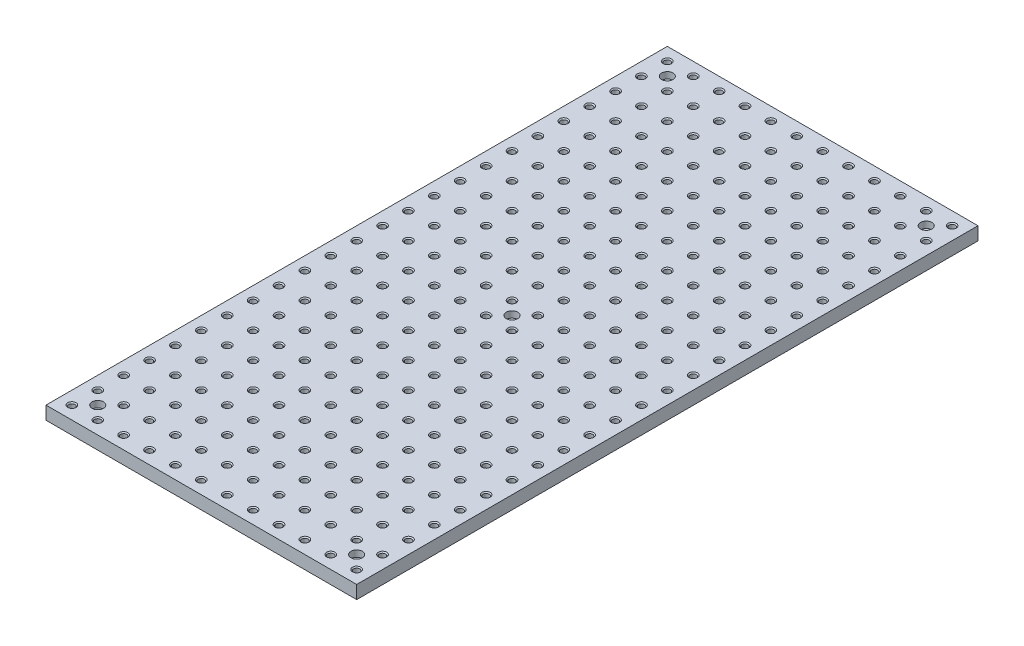
from build123d import *

# Parameters (mm, degrees)
SKETCH1_W                               = 300
SKETCH1_H                               = 600
BOSS_EXTRUDE1_DEPTH                     = 12.7
CBORE_FOR_M6_HEX_HEAD_BOLT1_D           = 6.6
CBORE_FOR_M6_HEX_HEAD_BOLT1_CBORE_D     = 11
CBORE_FOR_M6_HEX_HEAD_BOLT1_CBORE_DEPTH = 6.2
F_5_0_5_DIAMETER_HOLE1_OUTLINE_R        = 3
F_5_0_5_DIAMETER_HOLE1_DEPTH            = 12.7
CHAMFER1_SIZE                           = 1


with BuildPart() as part:
    # Sketch1 → Boss-Extrude1 (new body)
    with BuildSketch(Plane.XZ):
        with Locations((150, -300)):
            Rectangle(SKETCH1_W, SKETCH1_H)
    extrude(amount=-BOSS_EXTRUDE1_DEPTH)

    # CBORE for M6 Hex Head Bolt1 (through all)
    with Locations(Plane(origin=(0, 12.7, 0), x_dir=(1, 0, 0), z_dir=(0, 1, 0))):
        with Locations((25, 575), (275, 575), (275, 25), (25, 25), (150, 300)):
            CounterBoreHole(CBORE_FOR_M6_HEX_HEAD_BOLT1_D / 2, CBORE_FOR_M6_HEX_HEAD_BOLT1_CBORE_D / 2, CBORE_FOR_M6_HEX_HEAD_BOLT1_CBORE_DEPTH)

    # Ø5.0 (5) Diameter Hole1: read off the stored shape, not the designer's step
    # Ø5.0 (5) Diameter Hole1 outline → Ø5.0 (5) Diameter Hole1 (cut)
    with BuildSketch(Plane(origin=(0, 0, 0), x_dir=(1, 0, 0), z_dir=(0, 1, 0))):
        with Locations((287.5, 587.5)):
            Circle(F_5_0_5_DIAMETER_HOLE1_OUTLINE_R)
        with Locations((262.5, 587.5)):
            Circle(F_5_0_5_DIAMETER_HOLE1_OUTLINE_R)
        with Locations((237.5, 587.5)):
            Circle(F_5_0_5_DIAMETER_HOLE1_OUTLINE_R)
        with Locations((212.5, 587.5)):
            Circle(F_5_0_5_DIAMETER_HOLE1_OUTLINE_R)
        with Locations((187.5, 587.5)):
            Circle(F_5_0_5_DIAMETER_HOLE1_OUTLINE_R)
        with Locations((162.5, 587.5)):
            Circle(F_5_0_5_DIAMETER_HOLE1_OUTLINE_R)
        with Locations((137.5, 587.5)):
            Circle(F_5_0_5_DIAMETER_HOLE1_OUTLINE_R)
        with Locations((112.5, 587.5)):
            Circle(F_5_0_5_DIAMETER_HOLE1_OUTLINE_R)
        with Locations((87.5, 587.5)):
            Circle(F_5_0_5_DIAMETER_HOLE1_OUTLINE_R)
        with Locations((62.5, 587.5)):
            Circle(F_5_0_5_DIAMETER_HOLE1_OUTLINE_R)
        with Locations((37.5, 587.5)):
            Circle(F_5_0_5_DIAMETER_HOLE1_OUTLINE_R)
        with Locations((12.5, 587.5)):
            Circle(F_5_0_5_DIAMETER_HOLE1_OUTLINE_R)
        with Locations((287.5, 562.5)):
            Circle(F_5_0_5_DIAMETER_HOLE1_OUTLINE_R)
        with Locations((262.5, 562.5)):
            Circle(F_5_0_5_DIAMETER_HOLE1_OUTLINE_R)
        with Locations((237.5, 562.5)):
            Circle(F_5_0_5_DIAMETER_HOLE1_OUTLINE_R)
        with Locations((212.5, 562.5)):
            Circle(F_5_0_5_DIAMETER_HOLE1_OUTLINE_R)
        with Locations((187.5, 562.5)):
            Circle(F_5_0_5_DIAMETER_HOLE1_OUTLINE_R)
        with Locations((162.5, 562.5)):
            Circle(F_5_0_5_DIAMETER_HOLE1_OUTLINE_R)
        with Locations((137.5, 562.5)):
            Circle(F_5_0_5_DIAMETER_HOLE1_OUTLINE_R)
        with Locations((112.5, 562.5)):
            Circle(F_5_0_5_DIAMETER_HOLE1_OUTLINE_R)
        with Locations((87.5, 562.5)):
            Circle(F_5_0_5_DIAMETER_HOLE1_OUTLINE_R)
        with Locations((62.5, 562.5)):
            Circle(F_5_0_5_DIAMETER_HOLE1_OUTLINE_R)
        with Locations((37.5, 562.5)):
            Circle(F_5_0_5_DIAMETER_HOLE1_OUTLINE_R)
        with Locations((12.5, 562.5)):
            Circle(F_5_0_5_DIAMETER_HOLE1_OUTLINE_R)
        with Locations((287.5, 537.5)):
            Circle(F_5_0_5_DIAMETER_HOLE1_OUTLINE_R)
        with Locations((262.5, 537.5)):
            Circle(F_5_0_5_DIAMETER_HOLE1_OUTLINE_R)
        with Locations((237.5, 537.5)):
            Circle(F_5_0_5_DIAMETER_HOLE1_OUTLINE_R)
        with Locations((212.5, 537.5)):
            Circle(F_5_0_5_DIAMETER_HOLE1_OUTLINE_R)
        with Locations((187.5, 537.5)):
            Circle(F_5_0_5_DIAMETER_HOLE1_OUTLINE_R)
        with Locations((162.5, 537.5)):
            Circle(F_5_0_5_DIAMETER_HOLE1_OUTLINE_R)
        with Locations((137.5, 537.5)):
            Circle(F_5_0_5_DIAMETER_HOLE1_OUTLINE_R)
        with Locations((112.5, 537.5)):
            Circle(F_5_0_5_DIAMETER_HOLE1_OUTLINE_R)
        with Locations((87.5, 537.5)):
            Circle(F_5_0_5_DIAMETER_HOLE1_OUTLINE_R)
        with Locations((62.5, 537.5)):
            Circle(F_5_0_5_DIAMETER_HOLE1_OUTLINE_R)
        with Locations((37.5, 537.5)):
            Circle(F_5_0_5_DIAMETER_HOLE1_OUTLINE_R)
        with Locations((12.5, 537.5)):
            Circle(F_5_0_5_DIAMETER_HOLE1_OUTLINE_R)
        with Locations((287.5, 512.5)):
            Circle(F_5_0_5_DIAMETER_HOLE1_OUTLINE_R)
        with Locations((262.5, 512.5)):
            Circle(F_5_0_5_DIAMETER_HOLE1_OUTLINE_R)
        with Locations((237.5, 512.5)):
            Circle(F_5_0_5_DIAMETER_HOLE1_OUTLINE_R)
        with Locations((212.5, 512.5)):
            Circle(F_5_0_5_DIAMETER_HOLE1_OUTLINE_R)
        with Locations((187.5, 512.5)):
            Circle(F_5_0_5_DIAMETER_HOLE1_OUTLINE_R)
        with Locations((162.5, 512.5)):
            Circle(F_5_0_5_DIAMETER_HOLE1_OUTLINE_R)
        with Locations((137.5, 512.5)):
            Circle(F_5_0_5_DIAMETER_HOLE1_OUTLINE_R)
        with Locations((112.5, 512.5)):
            Circle(F_5_0_5_DIAMETER_HOLE1_OUTLINE_R)
        with Locations((87.5, 512.5)):
            Circle(F_5_0_5_DIAMETER_HOLE1_OUTLINE_R)
        with Locations((62.5, 512.5)):
            Circle(F_5_0_5_DIAMETER_HOLE1_OUTLINE_R)
        with Locations((37.5, 512.5)):
            Circle(F_5_0_5_DIAMETER_HOLE1_OUTLINE_R)
        with Locations((12.5, 512.5)):
            Circle(F_5_0_5_DIAMETER_HOLE1_OUTLINE_R)
        with Locations((287.5, 487.5)):
            Circle(F_5_0_5_DIAMETER_HOLE1_OUTLINE_R)
        with Locations((262.5, 487.5)):
            Circle(F_5_0_5_DIAMETER_HOLE1_OUTLINE_R)
        with Locations((237.5, 487.5)):
            Circle(F_5_0_5_DIAMETER_HOLE1_OUTLINE_R)
        with Locations((212.5, 487.5)):
            Circle(F_5_0_5_DIAMETER_HOLE1_OUTLINE_R)
        with Locations((187.5, 487.5)):
            Circle(F_5_0_5_DIAMETER_HOLE1_OUTLINE_R)
        with Locations((162.5, 487.5)):
            Circle(F_5_0_5_DIAMETER_HOLE1_OUTLINE_R)
        with Locations((137.5, 487.5)):
            Circle(F_5_0_5_DIAMETER_HOLE1_OUTLINE_R)
        with Locations((112.5, 487.5)):
            Circle(F_5_0_5_DIAMETER_HOLE1_OUTLINE_R)
        with Locations((87.5, 487.5)):
            Circle(F_5_0_5_DIAMETER_HOLE1_OUTLINE_R)
        with Locations((62.5, 487.5)):
            Circle(F_5_0_5_DIAMETER_HOLE1_OUTLINE_R)
        with Locations((37.5, 487.5)):
            Circle(F_5_0_5_DIAMETER_HOLE1_OUTLINE_R)
        with Locations((12.5, 487.5)):
            Circle(F_5_0_5_DIAMETER_HOLE1_OUTLINE_R)
        with Locations((287.5, 462.5)):
            Circle(F_5_0_5_DIAMETER_HOLE1_OUTLINE_R)
        with Locations((262.5, 462.5)):
            Circle(F_5_0_5_DIAMETER_HOLE1_OUTLINE_R)
        with Locations((237.5, 462.5)):
            Circle(F_5_0_5_DIAMETER_HOLE1_OUTLINE_R)
        with Locations((212.5, 462.5)):
            Circle(F_5_0_5_DIAMETER_HOLE1_OUTLINE_R)
        with Locations((187.5, 462.5)):
            Circle(F_5_0_5_DIAMETER_HOLE1_OUTLINE_R)
        with Locations((162.5, 462.5)):
            Circle(F_5_0_5_DIAMETER_HOLE1_OUTLINE_R)
        with Locations((137.5, 462.5)):
            Circle(F_5_0_5_DIAMETER_HOLE1_OUTLINE_R)
        with Locations((112.5, 462.5)):
            Circle(F_5_0_5_DIAMETER_HOLE1_OUTLINE_R)
        with Locations((87.5, 462.5)):
            Circle(F_5_0_5_DIAMETER_HOLE1_OUTLINE_R)
        with Locations((62.5, 462.5)):
            Circle(F_5_0_5_DIAMETER_HOLE1_OUTLINE_R)
        with Locations((37.5, 462.5)):
            Circle(F_5_0_5_DIAMETER_HOLE1_OUTLINE_R)
        with Locations((12.5, 462.5)):
            Circle(F_5_0_5_DIAMETER_HOLE1_OUTLINE_R)
        with Locations((287.5, 437.5)):
            Circle(F_5_0_5_DIAMETER_HOLE1_OUTLINE_R)
        with Locations((262.5, 437.5)):
            Circle(F_5_0_5_DIAMETER_HOLE1_OUTLINE_R)
        with Locations((237.5, 437.5)):
            Circle(F_5_0_5_DIAMETER_HOLE1_OUTLINE_R)
        with Locations((212.5, 437.5)):
            Circle(F_5_0_5_DIAMETER_HOLE1_OUTLINE_R)
        with Locations((187.5, 437.5)):
            Circle(F_5_0_5_DIAMETER_HOLE1_OUTLINE_R)
        with Locations((162.5, 437.5)):
            Circle(F_5_0_5_DIAMETER_HOLE1_OUTLINE_R)
        with Locations((137.5, 437.5)):
            Circle(F_5_0_5_DIAMETER_HOLE1_OUTLINE_R)
        with Locations((112.5, 437.5)):
            Circle(F_5_0_5_DIAMETER_HOLE1_OUTLINE_R)
        with Locations((87.5, 437.5)):
            Circle(F_5_0_5_DIAMETER_HOLE1_OUTLINE_R)
        with Locations((62.5, 437.5)):
            Circle(F_5_0_5_DIAMETER_HOLE1_OUTLINE_R)
        with Locations((37.5, 437.5)):
            Circle(F_5_0_5_DIAMETER_HOLE1_OUTLINE_R)
        with Locations((12.5, 437.5)):
            Circle(F_5_0_5_DIAMETER_HOLE1_OUTLINE_R)
        with Locations((287.5, 412.5)):
            Circle(F_5_0_5_DIAMETER_HOLE1_OUTLINE_R)
        with Locations((262.5, 412.5)):
            Circle(F_5_0_5_DIAMETER_HOLE1_OUTLINE_R)
        with Locations((237.5, 412.5)):
            Circle(F_5_0_5_DIAMETER_HOLE1_OUTLINE_R)
        with Locations((212.5, 412.5)):
            Circle(F_5_0_5_DIAMETER_HOLE1_OUTLINE_R)
        with Locations((187.5, 412.5)):
            Circle(F_5_0_5_DIAMETER_HOLE1_OUTLINE_R)
        with Locations((162.5, 412.5)):
            Circle(F_5_0_5_DIAMETER_HOLE1_OUTLINE_R)
        with Locations((137.5, 412.5)):
            Circle(F_5_0_5_DIAMETER_HOLE1_OUTLINE_R)
        with Locations((112.5, 412.5)):
            Circle(F_5_0_5_DIAMETER_HOLE1_OUTLINE_R)
        with Locations((87.5, 412.5)):
            Circle(F_5_0_5_DIAMETER_HOLE1_OUTLINE_R)
        with Locations((62.5, 412.5)):
            Circle(F_5_0_5_DIAMETER_HOLE1_OUTLINE_R)
        with Locations((37.5, 412.5)):
            Circle(F_5_0_5_DIAMETER_HOLE1_OUTLINE_R)
        with Locations((12.5, 412.5)):
            Circle(F_5_0_5_DIAMETER_HOLE1_OUTLINE_R)
        with Locations((287.5, 387.5)):
            Circle(F_5_0_5_DIAMETER_HOLE1_OUTLINE_R)
        with Locations((262.5, 387.5)):
            Circle(F_5_0_5_DIAMETER_HOLE1_OUTLINE_R)
        with Locations((237.5, 387.5)):
            Circle(F_5_0_5_DIAMETER_HOLE1_OUTLINE_R)
        with Locations((212.5, 387.5)):
            Circle(F_5_0_5_DIAMETER_HOLE1_OUTLINE_R)
        with Locations((187.5, 387.5)):
            Circle(F_5_0_5_DIAMETER_HOLE1_OUTLINE_R)
        with Locations((162.5, 387.5)):
            Circle(F_5_0_5_DIAMETER_HOLE1_OUTLINE_R)
        with Locations((137.5, 387.5)):
            Circle(F_5_0_5_DIAMETER_HOLE1_OUTLINE_R)
        with Locations((112.5, 387.5)):
            Circle(F_5_0_5_DIAMETER_HOLE1_OUTLINE_R)
        with Locations((87.5, 387.5)):
            Circle(F_5_0_5_DIAMETER_HOLE1_OUTLINE_R)
        with Locations((62.5, 387.5)):
            Circle(F_5_0_5_DIAMETER_HOLE1_OUTLINE_R)
        with Locations((37.5, 387.5)):
            Circle(F_5_0_5_DIAMETER_HOLE1_OUTLINE_R)
        with Locations((12.5, 387.5)):
            Circle(F_5_0_5_DIAMETER_HOLE1_OUTLINE_R)
        with Locations((287.5, 362.5)):
            Circle(F_5_0_5_DIAMETER_HOLE1_OUTLINE_R)
        with Locations((262.5, 362.5)):
            Circle(F_5_0_5_DIAMETER_HOLE1_OUTLINE_R)
        with Locations((237.5, 362.5)):
            Circle(F_5_0_5_DIAMETER_HOLE1_OUTLINE_R)
        with Locations((212.5, 362.5)):
            Circle(F_5_0_5_DIAMETER_HOLE1_OUTLINE_R)
        with Locations((187.5, 362.5)):
            Circle(F_5_0_5_DIAMETER_HOLE1_OUTLINE_R)
        with Locations((162.5, 362.5)):
            Circle(F_5_0_5_DIAMETER_HOLE1_OUTLINE_R)
        with Locations((137.5, 362.5)):
            Circle(F_5_0_5_DIAMETER_HOLE1_OUTLINE_R)
        with Locations((112.5, 362.5)):
            Circle(F_5_0_5_DIAMETER_HOLE1_OUTLINE_R)
        with Locations((87.5, 362.5)):
            Circle(F_5_0_5_DIAMETER_HOLE1_OUTLINE_R)
        with Locations((62.5, 362.5)):
            Circle(F_5_0_5_DIAMETER_HOLE1_OUTLINE_R)
        with Locations((37.5, 362.5)):
            Circle(F_5_0_5_DIAMETER_HOLE1_OUTLINE_R)
        with Locations((12.5, 362.5)):
            Circle(F_5_0_5_DIAMETER_HOLE1_OUTLINE_R)
        with Locations((287.5, 337.5)):
            Circle(F_5_0_5_DIAMETER_HOLE1_OUTLINE_R)
        with Locations((262.5, 337.5)):
            Circle(F_5_0_5_DIAMETER_HOLE1_OUTLINE_R)
        with Locations((237.5, 337.5)):
            Circle(F_5_0_5_DIAMETER_HOLE1_OUTLINE_R)
        with Locations((212.5, 337.5)):
            Circle(F_5_0_5_DIAMETER_HOLE1_OUTLINE_R)
        with Locations((187.5, 337.5)):
            Circle(F_5_0_5_DIAMETER_HOLE1_OUTLINE_R)
        with Locations((162.5, 337.5)):
            Circle(F_5_0_5_DIAMETER_HOLE1_OUTLINE_R)
        with Locations((137.5, 337.5)):
            Circle(F_5_0_5_DIAMETER_HOLE1_OUTLINE_R)
        with Locations((112.5, 337.5)):
            Circle(F_5_0_5_DIAMETER_HOLE1_OUTLINE_R)
        with Locations((87.5, 337.5)):
            Circle(F_5_0_5_DIAMETER_HOLE1_OUTLINE_R)
        with Locations((62.5, 337.5)):
            Circle(F_5_0_5_DIAMETER_HOLE1_OUTLINE_R)
        with Locations((37.5, 337.5)):
            Circle(F_5_0_5_DIAMETER_HOLE1_OUTLINE_R)
        with Locations((12.5, 337.5)):
            Circle(F_5_0_5_DIAMETER_HOLE1_OUTLINE_R)
        with Locations((287.5, 312.5)):
            Circle(F_5_0_5_DIAMETER_HOLE1_OUTLINE_R)
        with Locations((262.5, 312.5)):
            Circle(F_5_0_5_DIAMETER_HOLE1_OUTLINE_R)
        with Locations((237.5, 312.5)):
            Circle(F_5_0_5_DIAMETER_HOLE1_OUTLINE_R)
        with Locations((212.5, 312.5)):
            Circle(F_5_0_5_DIAMETER_HOLE1_OUTLINE_R)
        with Locations((187.5, 312.5)):
            Circle(F_5_0_5_DIAMETER_HOLE1_OUTLINE_R)
        with Locations((162.5, 312.5)):
            Circle(F_5_0_5_DIAMETER_HOLE1_OUTLINE_R)
        with Locations((137.5, 312.5)):
            Circle(F_5_0_5_DIAMETER_HOLE1_OUTLINE_R)
        with Locations((112.5, 312.5)):
            Circle(F_5_0_5_DIAMETER_HOLE1_OUTLINE_R)
        with Locations((87.5, 312.5)):
            Circle(F_5_0_5_DIAMETER_HOLE1_OUTLINE_R)
        with Locations((62.5, 312.5)):
            Circle(F_5_0_5_DIAMETER_HOLE1_OUTLINE_R)
        with Locations((37.5, 312.5)):
            Circle(F_5_0_5_DIAMETER_HOLE1_OUTLINE_R)
        with Locations((12.5, 312.5)):
            Circle(F_5_0_5_DIAMETER_HOLE1_OUTLINE_R)
        with Locations((287.5, 12.5)):
            Circle(F_5_0_5_DIAMETER_HOLE1_OUTLINE_R)
        with Locations((287.5, 37.5)):
            Circle(F_5_0_5_DIAMETER_HOLE1_OUTLINE_R)
        with Locations((287.5, 62.5)):
            Circle(F_5_0_5_DIAMETER_HOLE1_OUTLINE_R)
        with Locations((287.5, 87.5)):
            Circle(F_5_0_5_DIAMETER_HOLE1_OUTLINE_R)
        with Locations((287.5, 112.5)):
            Circle(F_5_0_5_DIAMETER_HOLE1_OUTLINE_R)
        with Locations((287.5, 137.5)):
            Circle(F_5_0_5_DIAMETER_HOLE1_OUTLINE_R)
        with Locations((287.5, 162.5)):
            Circle(F_5_0_5_DIAMETER_HOLE1_OUTLINE_R)
        with Locations((287.5, 187.5)):
            Circle(F_5_0_5_DIAMETER_HOLE1_OUTLINE_R)
        with Locations((287.5, 212.5)):
            Circle(F_5_0_5_DIAMETER_HOLE1_OUTLINE_R)
        with Locations((287.5, 237.5)):
            Circle(F_5_0_5_DIAMETER_HOLE1_OUTLINE_R)
        with Locations((287.5, 262.5)):
            Circle(F_5_0_5_DIAMETER_HOLE1_OUTLINE_R)
        with Locations((287.5, 287.5)):
            Circle(F_5_0_5_DIAMETER_HOLE1_OUTLINE_R)
        with Locations((262.5, 287.5)):
            Circle(F_5_0_5_DIAMETER_HOLE1_OUTLINE_R)
        with Locations((237.5, 287.5)):
            Circle(F_5_0_5_DIAMETER_HOLE1_OUTLINE_R)
        with Locations((212.5, 287.5)):
            Circle(F_5_0_5_DIAMETER_HOLE1_OUTLINE_R)
        with Locations((187.5, 287.5)):
            Circle(F_5_0_5_DIAMETER_HOLE1_OUTLINE_R)
        with Locations((162.5, 287.5)):
            Circle(F_5_0_5_DIAMETER_HOLE1_OUTLINE_R)
        with Locations((137.5, 287.5)):
            Circle(F_5_0_5_DIAMETER_HOLE1_OUTLINE_R)
        with Locations((112.5, 287.5)):
            Circle(F_5_0_5_DIAMETER_HOLE1_OUTLINE_R)
        with Locations((87.5, 287.5)):
            Circle(F_5_0_5_DIAMETER_HOLE1_OUTLINE_R)
        with Locations((62.5, 287.5)):
            Circle(F_5_0_5_DIAMETER_HOLE1_OUTLINE_R)
        with Locations((37.5, 287.5)):
            Circle(F_5_0_5_DIAMETER_HOLE1_OUTLINE_R)
        with Locations((12.5, 287.5)):
            Circle(F_5_0_5_DIAMETER_HOLE1_OUTLINE_R)
        with Locations((262.5, 12.5)):
            Circle(F_5_0_5_DIAMETER_HOLE1_OUTLINE_R)
        with Locations((262.5, 37.5)):
            Circle(F_5_0_5_DIAMETER_HOLE1_OUTLINE_R)
        with Locations((262.5, 62.5)):
            Circle(F_5_0_5_DIAMETER_HOLE1_OUTLINE_R)
        with Locations((262.5, 87.5)):
            Circle(F_5_0_5_DIAMETER_HOLE1_OUTLINE_R)
        with Locations((262.5, 112.5)):
            Circle(F_5_0_5_DIAMETER_HOLE1_OUTLINE_R)
        with Locations((262.5, 137.5)):
            Circle(F_5_0_5_DIAMETER_HOLE1_OUTLINE_R)
        with Locations((262.5, 162.5)):
            Circle(F_5_0_5_DIAMETER_HOLE1_OUTLINE_R)
        with Locations((262.5, 187.5)):
            Circle(F_5_0_5_DIAMETER_HOLE1_OUTLINE_R)
        with Locations((262.5, 212.5)):
            Circle(F_5_0_5_DIAMETER_HOLE1_OUTLINE_R)
        with Locations((262.5, 237.5)):
            Circle(F_5_0_5_DIAMETER_HOLE1_OUTLINE_R)
        with Locations((262.5, 262.5)):
            Circle(F_5_0_5_DIAMETER_HOLE1_OUTLINE_R)
        with Locations((237.5, 262.5)):
            Circle(F_5_0_5_DIAMETER_HOLE1_OUTLINE_R)
        with Locations((212.5, 262.5)):
            Circle(F_5_0_5_DIAMETER_HOLE1_OUTLINE_R)
        with Locations((187.5, 262.5)):
            Circle(F_5_0_5_DIAMETER_HOLE1_OUTLINE_R)
        with Locations((162.5, 262.5)):
            Circle(F_5_0_5_DIAMETER_HOLE1_OUTLINE_R)
        with Locations((137.5, 262.5)):
            Circle(F_5_0_5_DIAMETER_HOLE1_OUTLINE_R)
        with Locations((112.5, 262.5)):
            Circle(F_5_0_5_DIAMETER_HOLE1_OUTLINE_R)
        with Locations((87.5, 262.5)):
            Circle(F_5_0_5_DIAMETER_HOLE1_OUTLINE_R)
        with Locations((62.5, 262.5)):
            Circle(F_5_0_5_DIAMETER_HOLE1_OUTLINE_R)
        with Locations((37.5, 262.5)):
            Circle(F_5_0_5_DIAMETER_HOLE1_OUTLINE_R)
        with Locations((12.5, 262.5)):
            Circle(F_5_0_5_DIAMETER_HOLE1_OUTLINE_R)
        with Locations((237.5, 12.5)):
            Circle(F_5_0_5_DIAMETER_HOLE1_OUTLINE_R)
        with Locations((237.5, 37.5)):
            Circle(F_5_0_5_DIAMETER_HOLE1_OUTLINE_R)
        with Locations((237.5, 62.5)):
            Circle(F_5_0_5_DIAMETER_HOLE1_OUTLINE_R)
        with Locations((237.5, 87.5)):
            Circle(F_5_0_5_DIAMETER_HOLE1_OUTLINE_R)
        with Locations((237.5, 112.5)):
            Circle(F_5_0_5_DIAMETER_HOLE1_OUTLINE_R)
        with Locations((237.5, 137.5)):
            Circle(F_5_0_5_DIAMETER_HOLE1_OUTLINE_R)
        with Locations((237.5, 162.5)):
            Circle(F_5_0_5_DIAMETER_HOLE1_OUTLINE_R)
        with Locations((237.5, 187.5)):
            Circle(F_5_0_5_DIAMETER_HOLE1_OUTLINE_R)
        with Locations((237.5, 212.5)):
            Circle(F_5_0_5_DIAMETER_HOLE1_OUTLINE_R)
        with Locations((237.5, 237.5)):
            Circle(F_5_0_5_DIAMETER_HOLE1_OUTLINE_R)
        with Locations((212.5, 237.5)):
            Circle(F_5_0_5_DIAMETER_HOLE1_OUTLINE_R)
        with Locations((187.5, 237.5)):
            Circle(F_5_0_5_DIAMETER_HOLE1_OUTLINE_R)
        with Locations((162.5, 237.5)):
            Circle(F_5_0_5_DIAMETER_HOLE1_OUTLINE_R)
        with Locations((137.5, 237.5)):
            Circle(F_5_0_5_DIAMETER_HOLE1_OUTLINE_R)
        with Locations((112.5, 237.5)):
            Circle(F_5_0_5_DIAMETER_HOLE1_OUTLINE_R)
        with Locations((87.5, 237.5)):
            Circle(F_5_0_5_DIAMETER_HOLE1_OUTLINE_R)
        with Locations((62.5, 237.5)):
            Circle(F_5_0_5_DIAMETER_HOLE1_OUTLINE_R)
        with Locations((37.5, 237.5)):
            Circle(F_5_0_5_DIAMETER_HOLE1_OUTLINE_R)
        with Locations((12.5, 237.5)):
            Circle(F_5_0_5_DIAMETER_HOLE1_OUTLINE_R)
        with Locations((212.5, 12.5)):
            Circle(F_5_0_5_DIAMETER_HOLE1_OUTLINE_R)
        with Locations((212.5, 37.5)):
            Circle(F_5_0_5_DIAMETER_HOLE1_OUTLINE_R)
        with Locations((212.5, 62.5)):
            Circle(F_5_0_5_DIAMETER_HOLE1_OUTLINE_R)
        with Locations((212.5, 87.5)):
            Circle(F_5_0_5_DIAMETER_HOLE1_OUTLINE_R)
        with Locations((212.5, 112.5)):
            Circle(F_5_0_5_DIAMETER_HOLE1_OUTLINE_R)
        with Locations((212.5, 137.5)):
            Circle(F_5_0_5_DIAMETER_HOLE1_OUTLINE_R)
        with Locations((212.5, 162.5)):
            Circle(F_5_0_5_DIAMETER_HOLE1_OUTLINE_R)
        with Locations((212.5, 187.5)):
            Circle(F_5_0_5_DIAMETER_HOLE1_OUTLINE_R)
        with Locations((212.5, 212.5)):
            Circle(F_5_0_5_DIAMETER_HOLE1_OUTLINE_R)
        with Locations((187.5, 212.5)):
            Circle(F_5_0_5_DIAMETER_HOLE1_OUTLINE_R)
        with Locations((162.5, 212.5)):
            Circle(F_5_0_5_DIAMETER_HOLE1_OUTLINE_R)
        with Locations((137.5, 212.5)):
            Circle(F_5_0_5_DIAMETER_HOLE1_OUTLINE_R)
        with Locations((112.5, 212.5)):
            Circle(F_5_0_5_DIAMETER_HOLE1_OUTLINE_R)
        with Locations((87.5, 212.5)):
            Circle(F_5_0_5_DIAMETER_HOLE1_OUTLINE_R)
        with Locations((62.5, 212.5)):
            Circle(F_5_0_5_DIAMETER_HOLE1_OUTLINE_R)
        with Locations((37.5, 212.5)):
            Circle(F_5_0_5_DIAMETER_HOLE1_OUTLINE_R)
        with Locations((12.5, 212.5)):
            Circle(F_5_0_5_DIAMETER_HOLE1_OUTLINE_R)
        with Locations((187.5, 12.5)):
            Circle(F_5_0_5_DIAMETER_HOLE1_OUTLINE_R)
        with Locations((187.5, 37.5)):
            Circle(F_5_0_5_DIAMETER_HOLE1_OUTLINE_R)
        with Locations((187.5, 62.5)):
            Circle(F_5_0_5_DIAMETER_HOLE1_OUTLINE_R)
        with Locations((187.5, 87.5)):
            Circle(F_5_0_5_DIAMETER_HOLE1_OUTLINE_R)
        with Locations((187.5, 112.5)):
            Circle(F_5_0_5_DIAMETER_HOLE1_OUTLINE_R)
        with Locations((187.5, 137.5)):
            Circle(F_5_0_5_DIAMETER_HOLE1_OUTLINE_R)
        with Locations((187.5, 162.5)):
            Circle(F_5_0_5_DIAMETER_HOLE1_OUTLINE_R)
        with Locations((187.5, 187.5)):
            Circle(F_5_0_5_DIAMETER_HOLE1_OUTLINE_R)
        with Locations((162.5, 187.5)):
            Circle(F_5_0_5_DIAMETER_HOLE1_OUTLINE_R)
        with Locations((137.5, 187.5)):
            Circle(F_5_0_5_DIAMETER_HOLE1_OUTLINE_R)
        with Locations((112.5, 187.5)):
            Circle(F_5_0_5_DIAMETER_HOLE1_OUTLINE_R)
        with Locations((87.5, 187.5)):
            Circle(F_5_0_5_DIAMETER_HOLE1_OUTLINE_R)
        with Locations((62.5, 187.5)):
            Circle(F_5_0_5_DIAMETER_HOLE1_OUTLINE_R)
        with Locations((37.5, 187.5)):
            Circle(F_5_0_5_DIAMETER_HOLE1_OUTLINE_R)
        with Locations((12.5, 187.5)):
            Circle(F_5_0_5_DIAMETER_HOLE1_OUTLINE_R)
        with Locations((162.5, 12.5)):
            Circle(F_5_0_5_DIAMETER_HOLE1_OUTLINE_R)
        with Locations((162.5, 37.5)):
            Circle(F_5_0_5_DIAMETER_HOLE1_OUTLINE_R)
        with Locations((162.5, 62.5)):
            Circle(F_5_0_5_DIAMETER_HOLE1_OUTLINE_R)
        with Locations((162.5, 87.5)):
            Circle(F_5_0_5_DIAMETER_HOLE1_OUTLINE_R)
        with Locations((162.5, 112.5)):
            Circle(F_5_0_5_DIAMETER_HOLE1_OUTLINE_R)
        with Locations((162.5, 137.5)):
            Circle(F_5_0_5_DIAMETER_HOLE1_OUTLINE_R)
        with Locations((162.5, 162.5)):
            Circle(F_5_0_5_DIAMETER_HOLE1_OUTLINE_R)
        with Locations((137.5, 162.5)):
            Circle(F_5_0_5_DIAMETER_HOLE1_OUTLINE_R)
        with Locations((112.5, 162.5)):
            Circle(F_5_0_5_DIAMETER_HOLE1_OUTLINE_R)
        with Locations((87.5, 162.5)):
            Circle(F_5_0_5_DIAMETER_HOLE1_OUTLINE_R)
        with Locations((62.5, 162.5)):
            Circle(F_5_0_5_DIAMETER_HOLE1_OUTLINE_R)
        with Locations((37.5, 162.5)):
            Circle(F_5_0_5_DIAMETER_HOLE1_OUTLINE_R)
        with Locations((12.5, 162.5)):
            Circle(F_5_0_5_DIAMETER_HOLE1_OUTLINE_R)
        with Locations((137.5, 12.5)):
            Circle(F_5_0_5_DIAMETER_HOLE1_OUTLINE_R)
        with Locations((137.5, 37.5)):
            Circle(F_5_0_5_DIAMETER_HOLE1_OUTLINE_R)
        with Locations((137.5, 62.5)):
            Circle(F_5_0_5_DIAMETER_HOLE1_OUTLINE_R)
        with Locations((137.5, 87.5)):
            Circle(F_5_0_5_DIAMETER_HOLE1_OUTLINE_R)
        with Locations((137.5, 112.5)):
            Circle(F_5_0_5_DIAMETER_HOLE1_OUTLINE_R)
        with Locations((137.5, 137.5)):
            Circle(F_5_0_5_DIAMETER_HOLE1_OUTLINE_R)
        with Locations((112.5, 137.5)):
            Circle(F_5_0_5_DIAMETER_HOLE1_OUTLINE_R)
        with Locations((87.5, 137.5)):
            Circle(F_5_0_5_DIAMETER_HOLE1_OUTLINE_R)
        with Locations((62.5, 137.5)):
            Circle(F_5_0_5_DIAMETER_HOLE1_OUTLINE_R)
        with Locations((37.5, 137.5)):
            Circle(F_5_0_5_DIAMETER_HOLE1_OUTLINE_R)
        with Locations((12.5, 137.5)):
            Circle(F_5_0_5_DIAMETER_HOLE1_OUTLINE_R)
        with Locations((112.5, 12.5)):
            Circle(F_5_0_5_DIAMETER_HOLE1_OUTLINE_R)
        with Locations((112.5, 37.5)):
            Circle(F_5_0_5_DIAMETER_HOLE1_OUTLINE_R)
        with Locations((112.5, 62.5)):
            Circle(F_5_0_5_DIAMETER_HOLE1_OUTLINE_R)
        with Locations((112.5, 87.5)):
            Circle(F_5_0_5_DIAMETER_HOLE1_OUTLINE_R)
        with Locations((112.5, 112.5)):
            Circle(F_5_0_5_DIAMETER_HOLE1_OUTLINE_R)
        with Locations((87.5, 112.5)):
            Circle(F_5_0_5_DIAMETER_HOLE1_OUTLINE_R)
        with Locations((62.5, 112.5)):
            Circle(F_5_0_5_DIAMETER_HOLE1_OUTLINE_R)
        with Locations((37.5, 112.5)):
            Circle(F_5_0_5_DIAMETER_HOLE1_OUTLINE_R)
        with Locations((12.5, 112.5)):
            Circle(F_5_0_5_DIAMETER_HOLE1_OUTLINE_R)
        with Locations((87.5, 12.5)):
            Circle(F_5_0_5_DIAMETER_HOLE1_OUTLINE_R)
        with Locations((87.5, 37.5)):
            Circle(F_5_0_5_DIAMETER_HOLE1_OUTLINE_R)
        with Locations((87.5, 62.5)):
            Circle(F_5_0_5_DIAMETER_HOLE1_OUTLINE_R)
        with Locations((87.5, 87.5)):
            Circle(F_5_0_5_DIAMETER_HOLE1_OUTLINE_R)
        with Locations((62.5, 87.5)):
            Circle(F_5_0_5_DIAMETER_HOLE1_OUTLINE_R)
        with Locations((37.5, 87.5)):
            Circle(F_5_0_5_DIAMETER_HOLE1_OUTLINE_R)
        with Locations((12.5, 87.5)):
            Circle(F_5_0_5_DIAMETER_HOLE1_OUTLINE_R)
        with Locations((62.5, 12.5)):
            Circle(F_5_0_5_DIAMETER_HOLE1_OUTLINE_R)
        with Locations((62.5, 37.5)):
            Circle(F_5_0_5_DIAMETER_HOLE1_OUTLINE_R)
        with Locations((62.5, 62.5)):
            Circle(F_5_0_5_DIAMETER_HOLE1_OUTLINE_R)
        with Locations((37.5, 62.5)):
            Circle(F_5_0_5_DIAMETER_HOLE1_OUTLINE_R)
        with Locations((12.5, 62.5)):
            Circle(F_5_0_5_DIAMETER_HOLE1_OUTLINE_R)
        with Locations((37.5, 12.5)):
            Circle(F_5_0_5_DIAMETER_HOLE1_OUTLINE_R)
        with Locations((37.5, 37.5)):
            Circle(F_5_0_5_DIAMETER_HOLE1_OUTLINE_R)
        with Locations((12.5, 37.5)):
            Circle(F_5_0_5_DIAMETER_HOLE1_OUTLINE_R)
        with Locations((12.5, 12.5)):
            Circle(F_5_0_5_DIAMETER_HOLE1_OUTLINE_R)
    extrude(amount=F_5_0_5_DIAMETER_HOLE1_DEPTH, mode=Mode.SUBTRACT)

    # Chamfer1
    chamfer1_edges = [part.edges().sort_by_distance(p)[0] for p in [
        (134.5, 12.7, -287.5),
        (109.5, 12.7, -287.5),
        (84.5, 12.7, -287.5),
        (59.5, 12.7, -287.5),
        (234.5, 12.7, -562.5),
        (34.5, 12.7, -287.5),
        (9.5, 12.7, -287.5),
        (259.5, 12.7, -12.5),
        (259.5, 12.7, -37.5),
        (259.5, 12.7, -62.5),
        (259.5, 12.7, -87.5),
        (259.5, 12.7, -112.5),
        (259.5, 12.7, -137.5),
        (259.5, 12.7, -162.5),
        (259.5, 12.7, -187.5),
        (209.5, 12.7, -562.5),
        (259.5, 12.7, -212.5),
        (259.5, 12.7, -237.5),
        (259.5, 12.7, -262.5),
        (234.5, 12.7, -262.5),
        (209.5, 12.7, -262.5),
        (184.5, 12.7, -262.5),
        (159.5, 12.7, -262.5),
        (134.5, 12.7, -262.5),
        (109.5, 12.7, -262.5),
        (84.5, 12.7, -262.5),
        (184.5, 12.7, -562.5),
        (59.5, 12.7, -262.5),
        (34.5, 12.7, -262.5),
        (9.5, 12.7, -262.5),
        (234.5, 12.7, -12.5),
        (234.5, 12.7, -37.5),
        (234.5, 12.7, -62.5),
        (234.5, 12.7, -87.5),
        (234.5, 12.7, -112.5),
        (234.5, 12.7, -137.5),
        (234.5, 12.7, -162.5),
        (159.5, 12.7, -562.5),
        (234.5, 12.7, -187.5),
        (234.5, 12.7, -212.5),
        (234.5, 12.7, -237.5),
        (209.5, 12.7, -237.5),
        (184.5, 12.7, -237.5),
        (159.5, 12.7, -237.5),
        (134.5, 12.7, -237.5),
        (109.5, 12.7, -237.5),
        (84.5, 12.7, -237.5),
        (59.5, 12.7, -237.5),
        (134.5, 12.7, -562.5),
        (34.5, 12.7, -237.5),
        (9.5, 12.7, -237.5),
        (209.5, 12.7, -12.5),
        (209.5, 12.7, -37.5),
        (209.5, 12.7, -62.5),
        (209.5, 12.7, -87.5),
        (209.5, 12.7, -112.5),
        (209.5, 12.7, -137.5),
        (209.5, 12.7, -162.5),
        (209.5, 12.7, -187.5),
        (109.5, 12.7, -562.5),
        (209.5, 12.7, -212.5),
        (184.5, 12.7, -212.5),
        (159.5, 12.7, -212.5),
        (134.5, 12.7, -212.5),
        (109.5, 12.7, -212.5),
        (84.5, 12.7, -212.5),
        (59.5, 12.7, -212.5),
        (34.5, 12.7, -212.5),
        (9.5, 12.7, -212.5),
        (184.5, 12.7, -12.5),
        (84.5, 12.7, -562.5),
        (184.5, 12.7, -37.5),
        (184.5, 12.7, -62.5),
        (184.5, 12.7, -87.5),
        (184.5, 12.7, -112.5),
        (184.5, 12.7, -137.5),
        (184.5, 12.7, -162.5),
        (184.5, 12.7, -187.5),
        (159.5, 12.7, -187.5),
        (134.5, 12.7, -187.5),
        (109.5, 12.7, -187.5),
        (59.5, 12.7, -562.5),
        (84.5, 12.7, -187.5),
        (59.5, 12.7, -187.5),
        (34.5, 12.7, -187.5),
        (9.5, 12.7, -187.5),
        (159.5, 12.7, -12.5),
        (159.5, 12.7, -37.5),
        (159.5, 12.7, -62.5),
        (159.5, 12.7, -87.5),
        (159.5, 12.7, -112.5),
        (159.5, 12.7, -137.5),
        (34.5, 12.7, -562.5),
        (159.5, 12.7, -162.5),
        (134.5, 12.7, -162.5),
        (109.5, 12.7, -162.5),
        (84.5, 12.7, -162.5),
        (59.5, 12.7, -162.5),
        (34.5, 12.7, -162.5),
        (9.5, 12.7, -162.5),
        (134.5, 12.7, -12.5),
        (134.5, 12.7, -37.5),
        (134.5, 12.7, -62.5),
        (9.5, 12.7, -562.5),
        (134.5, 12.7, -87.5),
        (134.5, 12.7, -112.5),
        (134.5, 12.7, -137.5),
        (109.5, 12.7, -137.5),
        (84.5, 12.7, -137.5),
        (59.5, 12.7, -137.5),
        (34.5, 12.7, -137.5),
        (9.5, 12.7, -137.5),
        (109.5, 12.7, -12.5),
        (109.5, 12.7, -37.5),
        (284.5, 12.7, -537.5),
        (109.5, 12.7, -62.5),
        (109.5, 12.7, -87.5),
        (284.5, 12.7, -587.5),
        (109.5, 12.7, -112.5),
        (84.5, 12.7, -112.5),
        (59.5, 12.7, -112.5),
        (34.5, 12.7, -112.5),
        (9.5, 12.7, -112.5),
        (84.5, 12.7, -12.5),
        (84.5, 12.7, -37.5),
        (84.5, 12.7, -62.5),
        (259.5, 12.7, -537.5),
        (84.5, 12.7, -87.5),
        (59.5, 12.7, -87.5),
        (34.5, 12.7, -87.5),
        (9.5, 12.7, -87.5),
        (59.5, 12.7, -12.5),
        (59.5, 12.7, -37.5),
        (59.5, 12.7, -62.5),
        (34.5, 12.7, -62.5),
        (9.5, 12.7, -62.5),
        (34.5, 12.7, -12.5),
        (234.5, 12.7, -537.5),
        (34.5, 12.7, -37.5),
        (9.5, 12.7, -37.5),
        (9.5, 12.7, -12.5),
        (209.5, 12.7, -537.5),
        (184.5, 12.7, -537.5),
        (159.5, 12.7, -537.5),
        (134.5, 12.7, -537.5),
        (109.5, 12.7, -537.5),
        (84.5, 12.7, -537.5),
        (59.5, 12.7, -537.5),
        (34.5, 12.7, -537.5),
        (259.5, 12.7, -587.5),
        (9.5, 12.7, -537.5),
        (284.5, 12.7, -512.5),
        (259.5, 12.7, -512.5),
        (234.5, 12.7, -512.5),
        (209.5, 12.7, -512.5),
        (184.5, 12.7, -512.5),
        (159.5, 12.7, -512.5),
        (134.5, 12.7, -512.5),
        (109.5, 12.7, -512.5),
        (84.5, 12.7, -512.5),
        (234.5, 12.7, -587.5),
        (59.5, 12.7, -512.5),
        (34.5, 12.7, -512.5),
        (9.5, 12.7, -512.5),
        (284.5, 12.7, -487.5),
        (259.5, 12.7, -487.5),
        (234.5, 12.7, -487.5),
        (209.5, 12.7, -487.5),
        (184.5, 12.7, -487.5),
        (159.5, 12.7, -487.5),
        (134.5, 12.7, -487.5),
        (209.5, 12.7, -587.5),
        (109.5, 12.7, -487.5),
        (84.5, 12.7, -487.5),
        (59.5, 12.7, -487.5),
        (34.5, 12.7, -487.5),
        (9.5, 12.7, -487.5),
        (284.5, 12.7, -462.5),
        (259.5, 12.7, -462.5),
        (234.5, 12.7, -462.5),
        (209.5, 12.7, -462.5),
        (184.5, 12.7, -462.5),
        (184.5, 12.7, -587.5),
        (159.5, 12.7, -462.5),
        (134.5, 12.7, -462.5),
        (109.5, 12.7, -462.5),
        (84.5, 12.7, -462.5),
        (59.5, 12.7, -462.5),
        (34.5, 12.7, -462.5),
        (9.5, 12.7, -462.5),
        (284.5, 12.7, -437.5),
        (259.5, 12.7, -437.5),
        (234.5, 12.7, -437.5),
        (159.5, 12.7, -587.5),
        (209.5, 12.7, -437.5),
        (184.5, 12.7, -437.5),
        (159.5, 12.7, -437.5),
        (134.5, 12.7, -437.5),
        (109.5, 12.7, -437.5),
        (84.5, 12.7, -437.5),
        (59.5, 12.7, -437.5),
        (34.5, 12.7, -437.5),
        (9.5, 12.7, -437.5),
        (284.5, 12.7, -412.5),
        (134.5, 12.7, -587.5),
        (259.5, 12.7, -412.5),
        (234.5, 12.7, -412.5),
        (209.5, 12.7, -412.5),
        (184.5, 12.7, -412.5),
        (159.5, 12.7, -412.5),
        (134.5, 12.7, -412.5),
        (109.5, 12.7, -412.5),
        (84.5, 12.7, -412.5),
        (59.5, 12.7, -412.5),
        (34.5, 12.7, -412.5),
        (109.5, 12.7, -587.5),
        (9.5, 12.7, -412.5),
        (284.5, 12.7, -387.5),
        (259.5, 12.7, -387.5),
        (234.5, 12.7, -387.5),
        (209.5, 12.7, -387.5),
        (184.5, 12.7, -387.5),
        (159.5, 12.7, -387.5),
        (134.5, 12.7, -387.5),
        (109.5, 12.7, -387.5),
        (84.5, 12.7, -387.5),
        (84.5, 12.7, -587.5),
        (59.5, 12.7, -387.5),
        (34.5, 12.7, -387.5),
        (9.5, 12.7, -387.5),
        (284.5, 12.7, -362.5),
        (259.5, 12.7, -362.5),
        (234.5, 12.7, -362.5),
        (209.5, 12.7, -362.5),
        (184.5, 12.7, -362.5),
        (159.5, 12.7, -362.5),
        (134.5, 12.7, -362.5),
        (59.5, 12.7, -587.5),
        (109.5, 12.7, -362.5),
        (84.5, 12.7, -362.5),
        (59.5, 12.7, -362.5),
        (34.5, 12.7, -362.5),
        (9.5, 12.7, -362.5),
        (284.5, 12.7, -337.5),
        (259.5, 12.7, -337.5),
        (234.5, 12.7, -337.5),
        (209.5, 12.7, -337.5),
        (184.5, 12.7, -337.5),
        (34.5, 12.7, -587.5),
        (159.5, 12.7, -337.5),
        (134.5, 12.7, -337.5),
        (109.5, 12.7, -337.5),
        (84.5, 12.7, -337.5),
        (59.5, 12.7, -337.5),
        (34.5, 12.7, -337.5),
        (9.5, 12.7, -337.5),
        (284.5, 12.7, -312.5),
        (259.5, 12.7, -312.5),
        (234.5, 12.7, -312.5),
        (9.5, 12.7, -587.5),
        (209.5, 12.7, -312.5),
        (184.5, 12.7, -312.5),
        (159.5, 12.7, -312.5),
        (134.5, 12.7, -312.5),
        (109.5, 12.7, -312.5),
        (84.5, 12.7, -312.5),
        (59.5, 12.7, -312.5),
        (34.5, 12.7, -312.5),
        (9.5, 12.7, -312.5),
        (284.5, 12.7, -12.5),
        (284.5, 12.7, -562.5),
        (284.5, 12.7, -37.5),
        (284.5, 12.7, -62.5),
        (284.5, 12.7, -87.5),
        (284.5, 12.7, -112.5),
        (284.5, 12.7, -137.5),
        (284.5, 12.7, -162.5),
        (284.5, 12.7, -187.5),
        (284.5, 12.7, -212.5),
        (284.5, 12.7, -237.5),
        (284.5, 12.7, -262.5),
        (259.5, 12.7, -562.5),
        (284.5, 12.7, -287.5),
        (259.5, 12.7, -287.5),
        (234.5, 12.7, -287.5),
        (209.5, 12.7, -287.5),
        (184.5, 12.7, -287.5),
        (159.5, 12.7, -287.5),
    ]]
    chamfer(chamfer1_edges, length=CHAMFER1_SIZE)


solid = part.part
